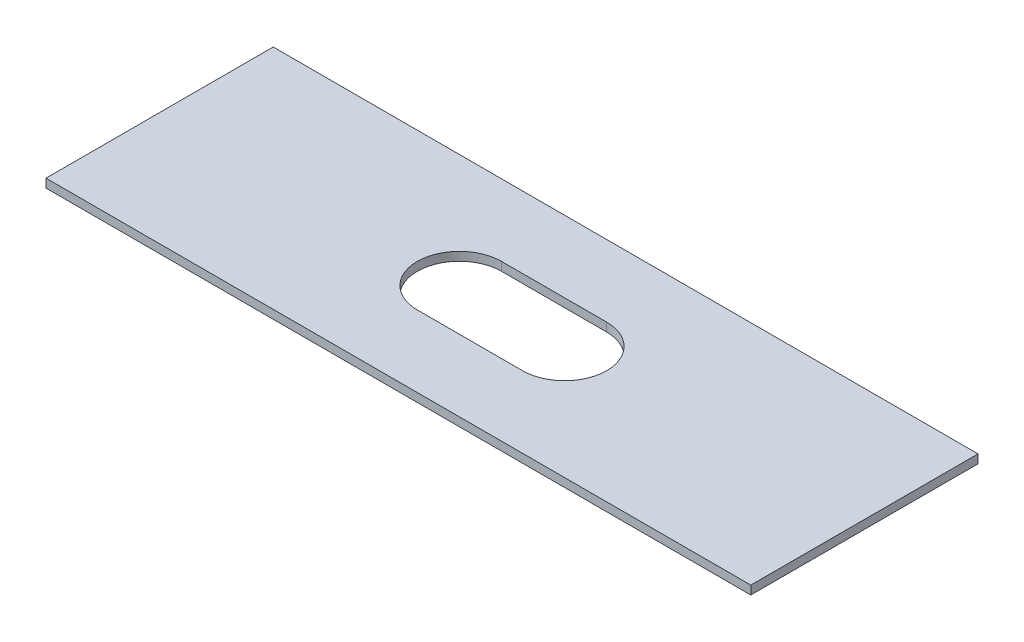
from build123d import *

# Parameters (mm, degrees)
SKETCH1_W           = 335
SKETCH1_H           = 108
BOSS_EXTRUDE2_DEPTH = 4.095165483
CUT_EXTRUDE1_DEPTH  = 5


with BuildPart() as part:
    # Sketch1 → Boss-Extrude2 (new body)
    with BuildSketch(Plane(origin=(0, 0, 0), x_dir=(1, 0, 0), z_dir=(0, 1, 0))):
        Rectangle(SKETCH1_W, SKETCH1_H)
    extrude(amount=BOSS_EXTRUDE2_DEPTH)

    # Sketch3 → Cut-Extrude1 (cut)
    with BuildSketch(Plane(origin=(0, 4.095165483, 0), x_dir=(1, 0, 0), z_dir=(0, 1, 0))):
        with BuildLine():
            Line((-25, 20), (25, 20))
            ThreePointArc((25, 20), (45, 0), (25, -20))
            Line((25, -20), (-25, -20))
            ThreePointArc((-25, -20), (-45, 0), (-25, 20))
        make_face()
    extrude(amount=-CUT_EXTRUDE1_DEPTH, mode=Mode.SUBTRACT)


solid = part.part
